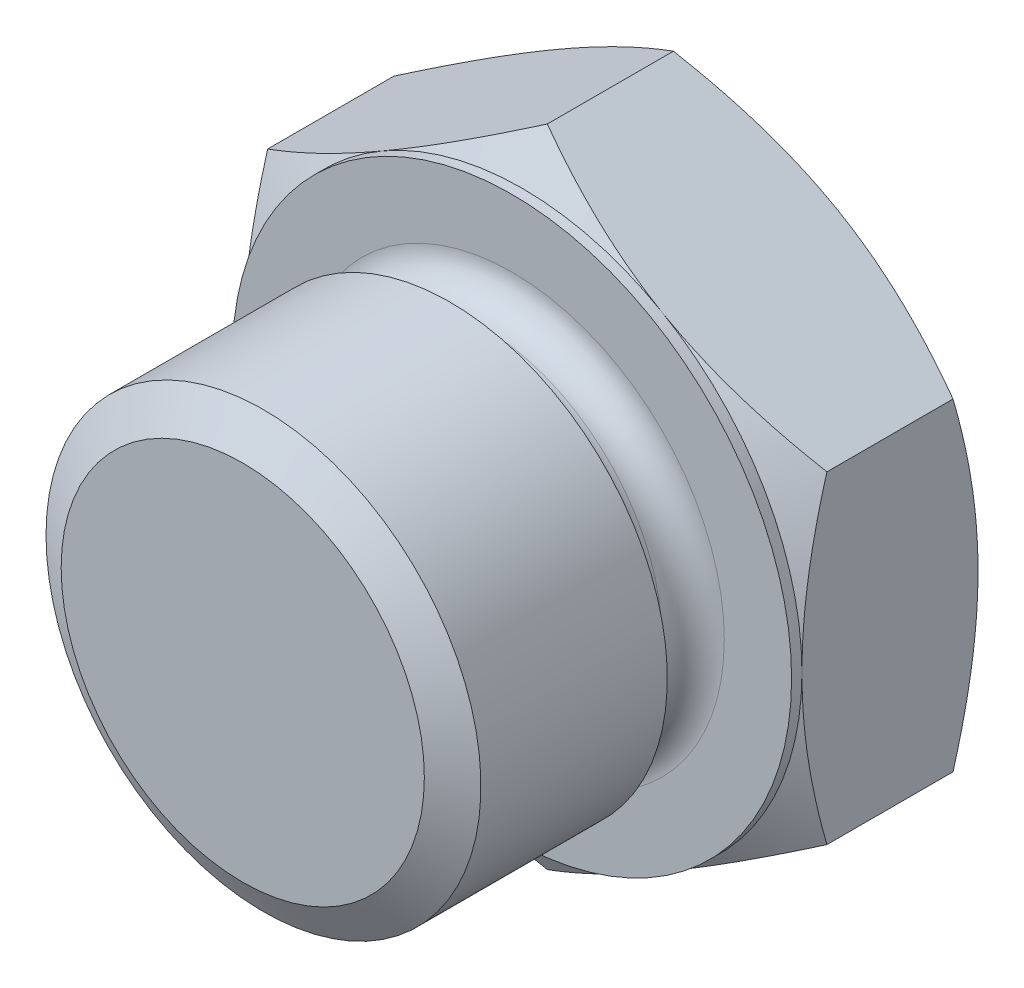
from build123d import *
from OCP.BRepFilletAPI import BRepFilletAPI_MakeChamfer

# Parameters (mm, degrees)
ESQUISSE1_R             = 16
BASE_EXTRUSION_DEPTH    = 8.5
CHANFREIN1_SIZE         = 2.5
CHANFREIN1_SIZE2        = 1.443375673
ESQUISSE2_OUTSIDE_W     = 43.21
ESQUISSE2_OUTSIDE_H     = 43.21
ENL_V_MAT_EXTRU_1_DEPTH = 25.171263931
ESQUISSE3_R             = 13.5
BOSS_EXTRU_1_DEPTH      = 0.5
ESQUISSE4_R             = 10.5
BOSS_EXTRU_2_DEPTH      = 13
CHANFREIN2_SIZE         = 1
CHANFREIN2_SIZE2        = 1.732050808
ESQUISSE5_OUTSIDE_W     = 38.348
ESQUISSE5_OUTSIDE_H     = 42.524
ESQUISSE5_OUTSIDE_R     = 8.75
ENL_V_MAT_EXTRU_2_DEPTH = 3
CONG_1_R                = 1.5


with BuildPart() as part:
    # Esquisse1 → Base-Extrusion (new body)
    with BuildSketch(Plane.XY):
        Circle(ESQUISSE1_R)
    extrude(amount=BASE_EXTRUSION_DEPTH)

    # Chanfrein1: one chamfer whose edges measure the first distance from different faces: ONE call of the kernel's chamfer builder (chamfer() names one face for all edges)
    chanfrein1_edges_1 = [part.edges().sort_by_distance(p)[0] for p in [
        (-16, 0, 0),
    ]]
    chanfrein1_side_1 = [part.faces().sort_by_distance(p)[0] for p in [
        (0, 0, 0),
    ]]
    chanfrein1_edges_2 = [part.edges().sort_by_distance(p)[0] for p in [
        (-16, 0, 8.5),
    ]]
    chanfrein1_side_2 = [part.faces().sort_by_distance(p)[0] for p in [
        (0, 0, 8.5),
    ]]
    chanfrein1 = BRepFilletAPI_MakeChamfer(part.part.solid().wrapped)
    for e in chanfrein1_edges_1:
        chanfrein1.Add(CHANFREIN1_SIZE, CHANFREIN1_SIZE2, e.wrapped, chanfrein1_side_1[0].wrapped)  # the first distance lies on this face
    for e in chanfrein1_edges_2:
        chanfrein1.Add(CHANFREIN1_SIZE, CHANFREIN1_SIZE2, e.wrapped, chanfrein1_side_2[0].wrapped)  # the first distance lies on this face
    add(Compound.cast(chanfrein1.Shape()), mode=Mode.REPLACE)

    # Esquisse2 outside → Enlèv. mat.-Extru.1 (cut, through all)
    with BuildSketch(Plane.XY.offset(8.5)):
        Rectangle(ESQUISSE2_OUTSIDE_W, ESQUISSE2_OUTSIDE_H)
        Polygon((13.5, -7.794228634), (13.5, 7.794228634), (0, 15.588457268), (-13.5, 7.794228634), (-13.5, -7.794228634), (0, -15.588457268), align=None, mode=Mode.SUBTRACT)
    extrude(amount=-ENL_V_MAT_EXTRU_1_DEPTH, mode=Mode.SUBTRACT)

    # Esquisse3 → Boss.-Extru.1 (add)
    with BuildSketch(Plane.XY.offset(8.5)):
        Circle(ESQUISSE3_R)
    extrude(amount=BOSS_EXTRU_1_DEPTH)

    # Esquisse4 → Boss.-Extru.2 (add)
    with BuildSketch(Plane.XY.offset(9)):
        with Locations(Location((0, 0, 0), (0, 0, 180))):
            Circle(ESQUISSE4_R)
    extrude(amount=BOSS_EXTRU_2_DEPTH)

    # Chanfrein2
    chanfrein2_edges = [part.edges().sort_by_distance(p)[0] for p in [
        (10.5, 0, 22),
    ]]
    chanfrein2_side = [part.faces().sort_by_distance(p)[0] for p in [
        (10.5, 0, 15.5),
    ]]
    chamfer(chanfrein2_edges, length=CHANFREIN2_SIZE, length2=CHANFREIN2_SIZE2, reference=chanfrein2_side[0])

    # Esquisse5 outside → Enlèv. mat.-Extru.2 (cut)
    with BuildSketch(Plane.XY.offset(9)):
        Rectangle(ESQUISSE5_OUTSIDE_W, ESQUISSE5_OUTSIDE_H)
        Circle(ESQUISSE5_OUTSIDE_R, mode=Mode.SUBTRACT)
    extrude(amount=ENL_V_MAT_EXTRU_2_DEPTH, mode=Mode.SUBTRACT)

    # Congé1
    cong_1_edges = [part.edges().sort_by_distance(p)[0] for p in [
        (-8.75, 0, 9),
        (-8.75, 0, 12),
    ]]
    fillet(cong_1_edges, radius=CONG_1_R - 0.0001)  # a hair under: the kernel refuses the full size


solid = part.part
